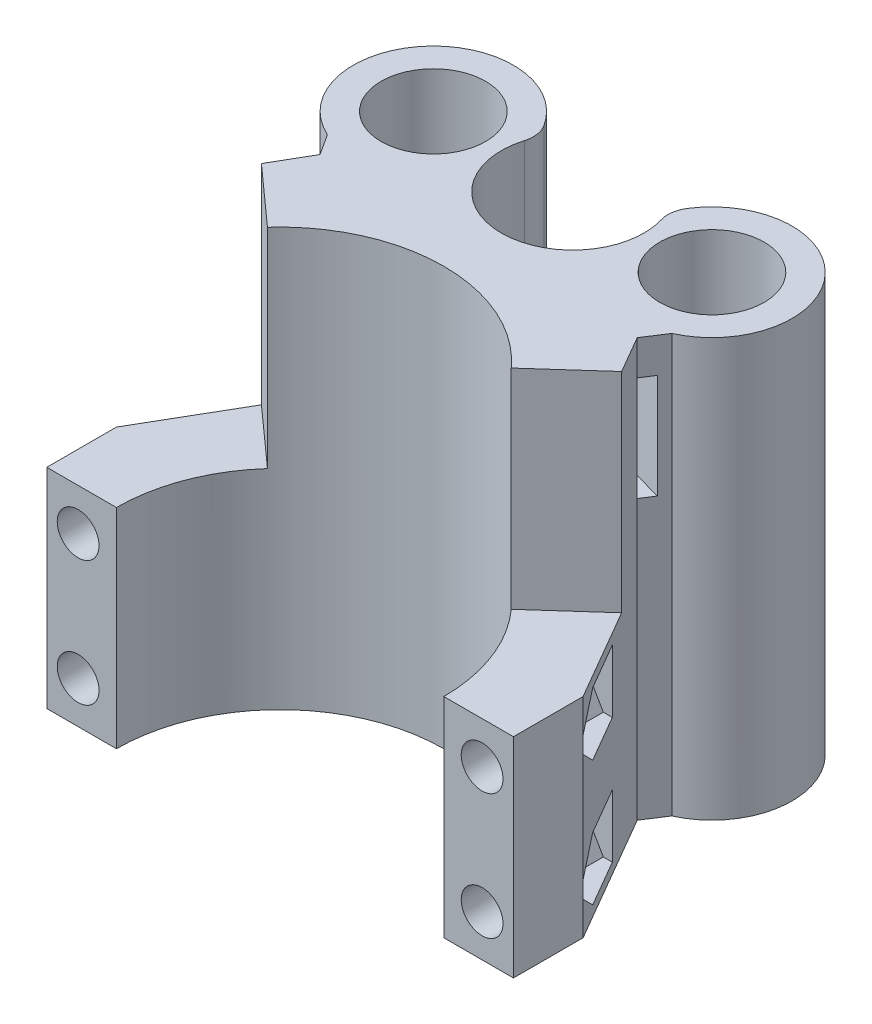
from build123d import *

# Parameters (mm, degrees)
SKETCH1_R           = 11.5
SKETCH1_R_2         = 7.5
BOSS_EXTRUDE1_DEPTH = 30
FILLET1_R           = 3
SKETCH2_R           = 11.75
CUT_EXTRUDE3_DEPTH  = 3
SKETCH3_R           = 11.75
SKETCH3_R_2         = 5.25
SKETCH3_R_3         = 2
BOSS_EXTRUDE2_DEPTH = 5
SKETCH4_W           = 40
SKETCH4_H           = 60
BOSS_EXTRUDE3_DEPTH = 2
SKETCH5_R           = 10.25
CUT_EXTRUDE4_DEPTH  = 27
FILLET2_START       = -3
FILLET2_DEPTH       = 34
BOSS_EXTRUDE4_DEPTH = 30
BOSS_EXTRUDE5_DEPTH = 30
CUT_EXTRUDE5_DEPTH  = 15
SKETCH9_R           = 3
CUT_EXTRUDE6_DEPTH  = 10
CUT_EXTRUDE7_DEPTH  = 10


with BuildPart() as part:
    # Sketch1 → Boss-Extrude1 (new, symmetric)
    # profile 1 of 3: a face of its own
    with BuildSketch(Plane(origin=(0, 0, 0), x_dir=(1, 0, 0), z_dir=(0, 1, 0))):
        with Locations((-20, 0)):
            Circle(SKETCH1_R)
        with Locations(Location((-20, 0, 0), (0, 0, 270))):
            Circle(SKETCH1_R_2, mode=Mode.SUBTRACT)
    # profile 2 of 3: a face of its own
    with BuildSketch(Plane(origin=(0, 0, 0), x_dir=(1, 0, 0), z_dir=(0, 1, 0))):
        with Locations((20, 0)):
            Circle(SKETCH1_R)
        with Locations(Location((20, 0, 0), (0, 0, 270))):
            Circle(SKETCH1_R_2, mode=Mode.SUBTRACT)
    # profile 3 of 3: a face of its own
    with BuildSketch(Plane(origin=(0, 0, 0), x_dir=(1, 0, 0), z_dir=(0, 1, 0))):
        with BuildLine():
            ThreePointArc((-10.513167019, -6.5), (-14.638097353, -10.173494975), (-20, -11.5))
            Line((-20, -11.5), (20, -11.5))
            ThreePointArc((20, -11.5), (14.638097353, -10.173494975), (10.513167019, -6.5))
            Line((10.513167019, -6.5), (-10.513167019, -6.5))
        make_face()
    extrude(amount=BOSS_EXTRUDE1_DEPTH, both=True)

    # Fillet1
    fillet1_edges = [part.edges().sort_by_distance(p)[0] for p in [
        (-10.513167019, 0, 6.5),
        (10.513167019, 0, 6.5),
    ]]
    fillet(fillet1_edges, radius=FILLET1_R)

    # Sketch2 → Cut-Extrude3 (cut, symmetric)
    with BuildSketch(Plane(origin=(0, 0, 0), x_dir=(1, 0, 0), z_dir=(0, 1, 0))):
        Circle(SKETCH2_R)
    extrude(amount=CUT_EXTRUDE3_DEPTH, both=True, mode=Mode.SUBTRACT)

    # Sketch3 → Boss-Extrude2 (add)
    with BuildSketch(Plane(origin=(0, -3, 0), x_dir=(1, 0, 0), z_dir=(0, 1, 0))):
        Circle(SKETCH3_R)
        with Locations(Location((0, 0, 0), (0, 0, 270))):
            Circle(SKETCH3_R_2, mode=Mode.SUBTRACT)
        with Locations(Location((5.656854249, 5.656854249, 0), (0, 0, 270))):
            Circle(SKETCH3_R_3, mode=Mode.SUBTRACT)
        with Locations(Location((-5.656854249, 5.656854249, 0), (0, 0, 270))):
            Circle(SKETCH3_R_3, mode=Mode.SUBTRACT)
    extrude(amount=-BOSS_EXTRUDE2_DEPTH)

    # Sketch4 → Boss-Extrude3 (add)
    with BuildSketch(Plane.XY.offset(11.5)):
        Rectangle(SKETCH4_W, SKETCH4_H)
    extrude(amount=BOSS_EXTRUDE3_DEPTH)

    # Chamfer1
    # the kernel refuses this chamfer: 8 mm, written as the material it adds along each edge
    with BuildSketch(Plane(origin=(20, -30, 11.5), x_dir=(0.9777449098895067, 0, -0.20979726210120203), z_dir=(0, 1, 0))) as chamfer1_piece_1_section:
        with BuildLine():
            Line((5.051611198, 0.22627417), (-1.544518324, -6.369855352))
            Line((-1.544518324, -6.369855352), (-1.70095751, -6.33628779))
            ThreePointArc((-1.70095751, -6.33628779), (-0.843748586, -3.169588005), (-0.156439186, 0.033567562))
            Line((-0.156439186, 0.033567562), (0.033567562, 0.156439186))
            ThreePointArc((0.033567562, 0.156439186), (2.527924683, -0.095347808), (5.018043636, 0.382713356))
            Line((5.018043636, 0.382713356), (5.051611198, 0.22627417))
        make_face()
    chamfer1_piece_1 = extrude(amount=60, mode=Mode.PRIVATE)
    chamfer1_piece_1 = split(chamfer1_piece_1, bisect_by=Plane(origin=(20, -30, 13.5), z_dir=(0, 0, -1)), keep=Keep.TOP, mode=Mode.PRIVATE)
    add(chamfer1_piece_1)
    with BuildSketch(Plane(origin=(-20, -30, 11.5), x_dir=(-0.9777449098895067, 0, -0.20979726210120223), z_dir=(0, 1, 0))) as chamfer1_piece_2_section:
        with BuildLine():
            Line((5.051611198, -0.22627417), (-1.544518324, 6.369855352))
            Line((-1.544518324, 6.369855352), (-1.70095751, 6.33628779))
            ThreePointArc((-1.70095751, 6.33628779), (-0.843748586, 3.169588005), (-0.156439186, -0.033567562))
            Line((-0.156439186, -0.033567562), (0.033567562, -0.156439186))
            ThreePointArc((0.033567562, -0.156439186), (2.527924683, 0.095347808), (5.018043636, -0.382713356))
            Line((5.018043636, -0.382713356), (5.051611198, -0.22627417))
        make_face()
    chamfer1_piece_2 = extrude(amount=60, mode=Mode.PRIVATE)
    chamfer1_piece_2 = split(chamfer1_piece_2, bisect_by=Plane(origin=(-20, -30, 13.5), z_dir=(0, 0, -1)), keep=Keep.TOP, mode=Mode.PRIVATE)
    add(chamfer1_piece_2)

    # Sketch5 → Cut-Extrude4 (cut)
    with BuildSketch(Plane(origin=(0, 30, 0), x_dir=(1, 0, 0), z_dir=(0, 1, 0))):
        Circle(SKETCH5_R)
    extrude(amount=-CUT_EXTRUDE4_DEPTH, mode=Mode.SUBTRACT)

    # Fillet2: read off the stored shape, not the designer's step
    # Fillet2 outline → Fillet2 (cut)
    with BuildSketch(Plane(origin=(0, 0, 0), x_dir=(1, 0, 0), z_dir=(0, 1, 0)).offset(FILLET2_START)):
        with BuildLine():
            ThreePointArc((-9.833031798, 2.893783968), (-9.601199579, 3.588797381), (-9.3203125, 4.265474757))
            ThreePointArc((-9.3203125, 4.265474757), (-9.763069468, 5.239776072), (-10.294479167, 6.168700459))
            ThreePointArc((-10.294479167, 6.168700459), (-9.709438477, 4.581166738), (-9.833031798, 2.893783968))
        make_face()
        with BuildLine():
            ThreePointArc((10.294479167, 6.168700459), (9.763069468, 5.239776072), (9.3203125, 4.265474757))
            ThreePointArc((9.3203125, 4.265474757), (9.601199579, 3.588797381), (9.833031798, 2.893783968))
            ThreePointArc((9.833031798, 2.893783968), (9.709438477, 4.581166738), (10.294479167, 6.168700459))
        make_face()
    extrude(amount=FILLET2_DEPTH, mode=Mode.SUBTRACT)

    # Sketch6 → Boss-Extrude4 (add)
    with BuildSketch(Plane.XZ.offset(30)):
        with BuildLine():
            ThreePointArc((-23.5, 42), (0, 18.5), (23.5, 42))
            Line((23.5, 42), (33.5, 42))
            Line((33.5, 42), (33.5, 32))
            Line((33.5, 32), (22.769957826, 13.5))
            Line((22.769957826, 13.5), (-22.769957826, 13.5))
            Line((-22.769957826, 13.5), (-33.5, 32))
            Line((-33.5, 32), (-33.5, 42))
            Line((-33.5, 42), (-23.5, 42))
        make_face()
    extrude(amount=-BOSS_EXTRUDE4_DEPTH)

    # Sketch7 → Boss-Extrude5 (add)
    with BuildSketch(Plane(origin=(0, 0, 0), x_dir=(1, 0, 0), z_dir=(0, 1, 0))):
        with BuildLine():
            Line((0, -13.5), (0, -18.5))
            ThreePointArc((0, -18.5), (9.582977152, -20.542680761), (17.5, -26.315612859))
            Line((17.5, -26.315612859), (25.858213649, -18.824558077))
            Line((25.858213649, -18.824558077), (22.769957826, -13.5))
            Line((22.769957826, -13.5), (0, -13.5))
        make_face()
        with BuildLine():
            Line((-22.769957826, -13.5), (-25.858213649, -18.824558077))
            Line((-25.858213649, -18.824558077), (-17.5, -26.315612859))
            ThreePointArc((-17.5, -26.315612859), (-9.582977152, -20.542680761), (0, -18.5))
            Line((0, -18.5), (0, -13.5))
            Line((0, -13.5), (-22.769957826, -13.5))
        make_face()
    extrude(amount=BOSS_EXTRUDE5_DEPTH)

    # Sketch8 → Cut-Extrude5 (cut)
    with BuildSketch(Plane(origin=(0, 25, 0), x_dir=(1, 0, 0), z_dir=(0, 1, 0))):
        with BuildLine():
            Line((30.953633553, -14.257784453), (29.292282812, -15.746771207))
            ThreePointArc((29.292282812, -15.746771207), (0, -10.191127392), (-29.292282812, -15.746771207))
            Line((-29.292282812, -15.746771207), (-30.953633553, -14.257784453))
            ThreePointArc((-30.953633553, -14.257784453), (0, -8.191127392), (30.953633553, -14.257784453))
        make_face()
    extrude(amount=-CUT_EXTRUDE5_DEPTH, mode=Mode.SUBTRACT)

    # Sketch9 → Cut-Extrude6 (cut)
    with BuildSketch(Plane.XY.offset(42)):
        with Locations((29, -6)):
            Circle(SKETCH9_R)
        with Locations(Location((-29, -6, 0), (0, 0, 180))):
            Circle(SKETCH9_R)
        with Locations((-29, -24)):
            Circle(SKETCH9_R)
        with Locations(Location((29, -24, 0), (0, 0, 180))):
            Circle(SKETCH9_R)
    extrude(amount=-CUT_EXTRUDE6_DEPTH, mode=Mode.SUBTRACT)

    # Sketch10 → Cut-Extrude7 (cut)
    with BuildSketch(Plane.XY.offset(32)):
        Polygon((34.196152423, -6), (31.598076211, -1.5), (26.401923789, -1.5), (23.803847577, -6), (26.401923789, -10.5), (31.598076211, -10.5), align=None)
        Polygon((31.598076211, -19.5), (34.196152423, -24), (31.598076211, -28.5), (26.401923789, -28.5), (23.803847577, -24), (26.401923789, -19.5), align=None)
        Polygon((-34.196152423, -24), (-31.598076211, -28.5), (-26.401923789, -28.5), (-23.803847577, -24), (-26.401923789, -19.5), (-31.598076211, -19.5), align=None)
        Polygon((-31.598076211, -10.5), (-34.196152423, -6), (-31.598076211, -1.5), (-26.401923789, -1.5), (-23.803847577, -6), (-26.401923789, -10.5), align=None)
    extrude(amount=-CUT_EXTRUDE7_DEPTH, mode=Mode.SUBTRACT)


solid = part.part
